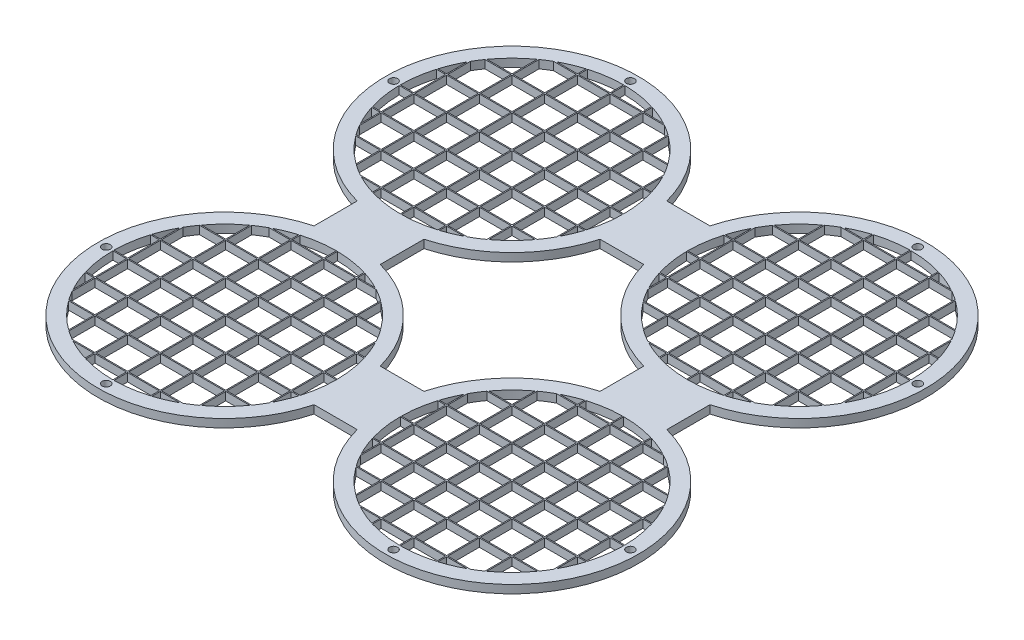
from build123d import *

# Parameters (mm, degrees)
SKETCH2_R           = 46
SKETCH2_R_2         = 41
BOSS_EXTRUDE2_DEPTH = 3
EXTRUDE_THIN5_START = -3
SKETCH4_R           = 46.4
SKETCH4_R_2         = 46
SKETCH4_W           = 0.4
SKETCH4_H           = 92
SKETCH4_H_2         = 88.814413244
SKETCH4_H_3         = 78.485667482
SKETCH4_H_4         = 57.271284254
SKETCH4_W_2         = 92
SKETCH4_H_5         = 0.4
SKETCH4_W_3         = 88.814413244
SKETCH4_W_4         = 78.485667482
SKETCH4_W_5         = 57.271284254
EXTRUDE_THIN5_DEPTH = 3
SKETCH5_R           = 1.5
CUT_EXTRUDE1_DEPTH  = 3
SKETCH6_W           = 22.316308175
SKETCH6_H           = 24.4
BOSS_EXTRUDE3_DEPTH = 3
SKETCH7_W           = 24.4
SKETCH7_H           = 22.389401367
BOSS_EXTRUDE4_DEPTH = 3
SKETCH8_W           = 24.4
SKETCH8_H           = 22.403445119
BOSS_EXTRUDE5_DEPTH = 3


with BuildPart() as part:
    # Sketch2 → Boss-Extrude2 (new body)
    with BuildSketch(Plane(origin=(0, 0, 0), x_dir=(1, 0, 0), z_dir=(0, 1, 0))):
        with Locations(Location((0, 0, 0), (0, 0, 270))):
            Circle(SKETCH2_R)
        with Locations(Location((0, 0, 0), (0, 0, 270))):
            Circle(SKETCH2_R_2, mode=Mode.SUBTRACT)
    extrude(amount=BOSS_EXTRUDE2_DEPTH)

    # Sketch4 → Extrude-Thin5 (add)
    # profile 1 of 15: a face of its own
    with BuildSketch(Plane(origin=(0, 3, 0), x_dir=(1, 0, 0), z_dir=(0, 1, 0)).offset(EXTRUDE_THIN5_START)):
        Circle(SKETCH4_R)
        Circle(SKETCH4_R_2, mode=Mode.SUBTRACT)
    # profile 2 of 15: a face of its own
    with BuildSketch(Plane(origin=(0, 3, 0), x_dir=(1, 0, 0), z_dir=(0, 1, 0)).offset(EXTRUDE_THIN5_START)):
        with Locations((-0.2, 0)):
            Rectangle(SKETCH4_W, SKETCH4_H)
    # profile 3 of 15: a face of its own
    with BuildSketch(Plane(origin=(0, 3, 0), x_dir=(1, 0, 0), z_dir=(0, 1, 0)).offset(EXTRUDE_THIN5_START)):
        with Locations((11.8, 0)):
            Rectangle(SKETCH4_W, SKETCH4_H_2)
    # profile 4 of 15: a face of its own
    with BuildSketch(Plane(origin=(0, 3, 0), x_dir=(1, 0, 0), z_dir=(0, 1, 0)).offset(EXTRUDE_THIN5_START)):
        with Locations((23.8, 0)):
            Rectangle(SKETCH4_W, SKETCH4_H_3)
    # profile 5 of 15: a face of its own
    with BuildSketch(Plane(origin=(0, 3, 0), x_dir=(1, 0, 0), z_dir=(0, 1, 0)).offset(EXTRUDE_THIN5_START)):
        with Locations((35.8, 0)):
            Rectangle(SKETCH4_W, SKETCH4_H_4)
    # profile 6 of 15: a face of its own
    with BuildSketch(Plane(origin=(0, 3, 0), x_dir=(1, 0, 0), z_dir=(0, 1, 0)).offset(EXTRUDE_THIN5_START)):
        with Locations((-12.2, 0)):
            Rectangle(SKETCH4_W, SKETCH4_H_2)
    # profile 7 of 15: a face of its own
    with BuildSketch(Plane(origin=(0, 3, 0), x_dir=(1, 0, 0), z_dir=(0, 1, 0)).offset(EXTRUDE_THIN5_START)):
        with Locations((-24.2, 0)):
            Rectangle(SKETCH4_W, SKETCH4_H_3)
    # profile 8 of 15: a face of its own
    with BuildSketch(Plane(origin=(0, 3, 0), x_dir=(1, 0, 0), z_dir=(0, 1, 0)).offset(EXTRUDE_THIN5_START)):
        with Locations((-36.2, 0)):
            Rectangle(SKETCH4_W, SKETCH4_H_4)
    # profile 9 of 15: a face of its own
    with BuildSketch(Plane(origin=(0, 3, 0), x_dir=(1, 0, 0), z_dir=(0, 1, 0)).offset(EXTRUDE_THIN5_START)):
        with Locations((0, -0.2)):
            Rectangle(SKETCH4_W_2, SKETCH4_H_5)
    # profile 10 of 15: a face of its own
    with BuildSketch(Plane(origin=(0, 3, 0), x_dir=(1, 0, 0), z_dir=(0, 1, 0)).offset(EXTRUDE_THIN5_START)):
        with Locations((0, -12.2)):
            Rectangle(SKETCH4_W_3, SKETCH4_H_5)
    # profile 11 of 15: a face of its own
    with BuildSketch(Plane(origin=(0, 3, 0), x_dir=(1, 0, 0), z_dir=(0, 1, 0)).offset(EXTRUDE_THIN5_START)):
        with Locations((0, -24.2)):
            Rectangle(SKETCH4_W_4, SKETCH4_H_5)
    # profile 12 of 15: a face of its own
    with BuildSketch(Plane(origin=(0, 3, 0), x_dir=(1, 0, 0), z_dir=(0, 1, 0)).offset(EXTRUDE_THIN5_START)):
        with Locations((0, -36.2)):
            Rectangle(SKETCH4_W_5, SKETCH4_H_5)
    # profile 13 of 15: a face of its own
    with BuildSketch(Plane(origin=(0, 3, 0), x_dir=(1, 0, 0), z_dir=(0, 1, 0)).offset(EXTRUDE_THIN5_START)):
        with Locations((0, 11.8)):
            Rectangle(SKETCH4_W_3, SKETCH4_H_5)
    # profile 14 of 15: a face of its own
    with BuildSketch(Plane(origin=(0, 3, 0), x_dir=(1, 0, 0), z_dir=(0, 1, 0)).offset(EXTRUDE_THIN5_START)):
        with Locations((0, 23.8)):
            Rectangle(SKETCH4_W_4, SKETCH4_H_5)
    # profile 15 of 15: a face of its own
    with BuildSketch(Plane(origin=(0, 3, 0), x_dir=(1, 0, 0), z_dir=(0, 1, 0)).offset(EXTRUDE_THIN5_START)):
        with Locations((0, 35.8)):
            Rectangle(SKETCH4_W_5, SKETCH4_H_5)
    extrude(amount=EXTRUDE_THIN5_DEPTH)

    # Sketch5 → Cut-Extrude1 (cut)
    with BuildSketch(Plane.XZ):
        with Locations(Location((0, -43.452428413, 0), (0, 0, 270))):
            Circle(SKETCH5_R)
        with Locations(Location((43.452428413, 0, 0), (0, 0, 270))):
            Circle(SKETCH5_R)
    extrude(amount=-CUT_EXTRUDE1_DEPTH, mode=Mode.SUBTRACT)


with BuildPart() as body_2:
    # Mirror6: mirrored copy
    add(part.part.mirror(Plane(origin=(-52.73, 0, 0), x_dir=(0, 0, 1), z_dir=(1, 0, 0))))


with BuildPart() as part_1:
    add(part.part)

    add(body_2.part)  # Boss-Extrude3 merges body 2
    # Sketch6 → Boss-Extrude3 (add)
    with BuildSketch(Plane.XZ):
        with Locations((-52.71547111, 0.2)):
            Rectangle(SKETCH6_W, SKETCH6_H)
    extrude(amount=-BOSS_EXTRUDE3_DEPTH)


with BuildPart() as body_2_2:
    # Mirror8: mirrored copy
    add(part_1.part.mirror(Plane.XY.offset(52.73)))


with BuildPart() as part_2:
    add(part_1.part)

    add(body_2_2.part)  # Boss-Extrude4 merges body 2 2
    # Sketch7 → Boss-Extrude4 (add)
    with BuildSketch(Plane(origin=(0, 3, 0), x_dir=(1, 0, 0), z_dir=(0, 1, 0))):
        with Locations((-105.26, -52.811859226)):
            Rectangle(SKETCH7_W, SKETCH7_H)
    extrude(amount=-BOSS_EXTRUDE4_DEPTH)

    # Sketch8 → Boss-Extrude5 (add)
    with BuildSketch(Plane(origin=(0, 3, 0), x_dir=(1, 0, 0), z_dir=(0, 1, 0))):
        with Locations((-0.2, -52.962857308)):
            Rectangle(SKETCH8_W, SKETCH8_H)
    extrude(amount=-BOSS_EXTRUDE5_DEPTH)


solid = part_2.part
